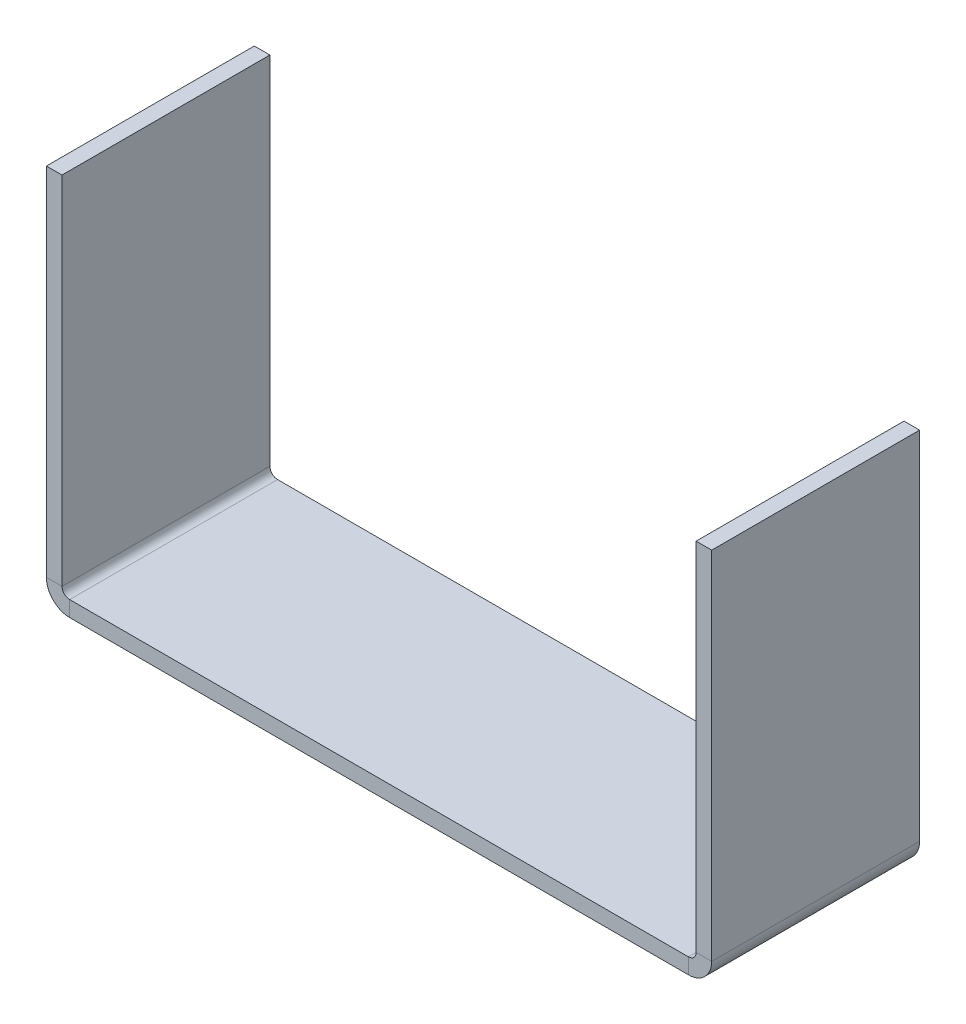
from build123d import *

# Parameters (mm, degrees)
SKETCH_1_W                       = 64
SKETCH_1_H                       = 20
SM_BASE_FLANGE_1_DEPTH           = 1.5
SM_EDGE_FLANGE_1_STRIP_W         = 7.4732
SM_EDGE_FLANGE_1_STRIP_H         = 1.5
SM_EDGE_FLANGE_1_STRIP_CUT_DEPTH = 20
SM_EDGE_FLANGE_1_DEPTH           = 20
SM_EDGE_FLANGE_2_STRIP_W         = 7.4732
SM_EDGE_FLANGE_2_STRIP_H         = 1.5
SM_EDGE_FLANGE_2_STRIP_CUT_DEPTH = 20
SM_EDGE_FLANGE_2_DEPTH           = 20


# Sheet-metal steps are written as plain solids
with BuildPart() as part:
    # Sketch 1 → Базовая кромка1 (new body)
    with BuildSketch(Plane(origin=(0, 0, 0), x_dir=(1, 0, 0), z_dir=(0, 1, 0))):
        with Locations((32, 10)):
            Rectangle(SKETCH_1_W, SKETCH_1_H)
    extrude(amount=-SM_BASE_FLANGE_1_DEPTH)

    # Ребро-кромка1 strip (across the edge) → Ребро-кромка1 strip cut (cut)
    with BuildSketch(Plane.XY.offset(-20)):
        with Locations((-1.5, -0.75)):
            Rectangle(SM_EDGE_FLANGE_1_STRIP_W, SM_EDGE_FLANGE_1_STRIP_H)
    extrude(amount=SM_EDGE_FLANGE_1_STRIP_CUT_DEPTH, mode=Mode.SUBTRACT)

    # Ребро-кромка1 section (across the edge) → Ребро-кромка1 (add)
    with BuildSketch(Plane.XY.offset(-20)):
        with BuildLine():
            Line((0, 0.7366), (0, 35))
            Line((0, 35), (1.5, 35))
            Line((1.5, 35), (1.5, 0.7366))
            ThreePointArc((1.5, 0.7366), (1.715745145, 0.215745145), (2.2366, 0))
            Line((2.2366, 0), (2.2366, -1.5))
            ThreePointArc((2.2366, -1.5), (0.655084973, -0.844915027), (0, 0.7366))
        make_face()
    extrude(amount=SM_EDGE_FLANGE_1_DEPTH)

    # Ребро-кромка2 strip (across the edge) → Ребро-кромка2 strip cut (cut)
    with BuildSketch(Plane(origin=(64, 0, 0), x_dir=(-1, 0, 0), z_dir=(0, 0, -1))):
        with Locations((-1.5, -0.75)):
            Rectangle(SM_EDGE_FLANGE_2_STRIP_W, SM_EDGE_FLANGE_2_STRIP_H)
    extrude(amount=SM_EDGE_FLANGE_2_STRIP_CUT_DEPTH, mode=Mode.SUBTRACT)

    # Ребро-кромка2 section (across the edge) → Ребро-кромка2 (add)
    with BuildSketch(Plane(origin=(64, 0, 0), x_dir=(-1, 0, 0), z_dir=(0, 0, -1))):
        with BuildLine():
            Line((0, 0.7366), (0, 35))
            Line((0, 35), (1.5, 35))
            Line((1.5, 35), (1.5, 0.7366))
            ThreePointArc((1.5, 0.7366), (1.715745145, 0.215745145), (2.2366, 0))
            Line((2.2366, 0), (2.2366, -1.5))
            ThreePointArc((2.2366, -1.5), (0.655084973, -0.844915027), (0, 0.7366))
        make_face()
    extrude(amount=SM_EDGE_FLANGE_2_DEPTH)


solid = part.part
